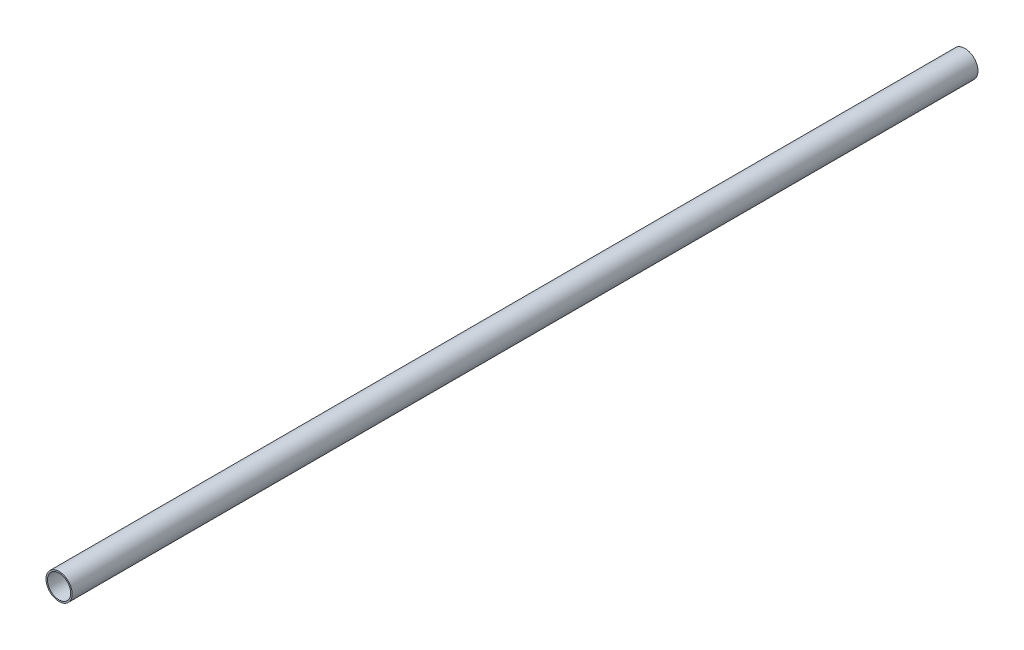
from build123d import *

# Parameters (mm, degrees)
SKETCH1_R           = 3.57505
SKETCH1_R_2         = 3.175
BOSS_EXTRUDE1_DEPTH = 123.825


with BuildPart() as part:
    # Sketch1 → Boss-Extrude1 (new, symmetric)
    with BuildSketch(Plane.XY):
        Circle(SKETCH1_R)
        Circle(SKETCH1_R_2, mode=Mode.SUBTRACT)
    extrude(amount=BOSS_EXTRUDE1_DEPTH, both=True)


solid = part.part
